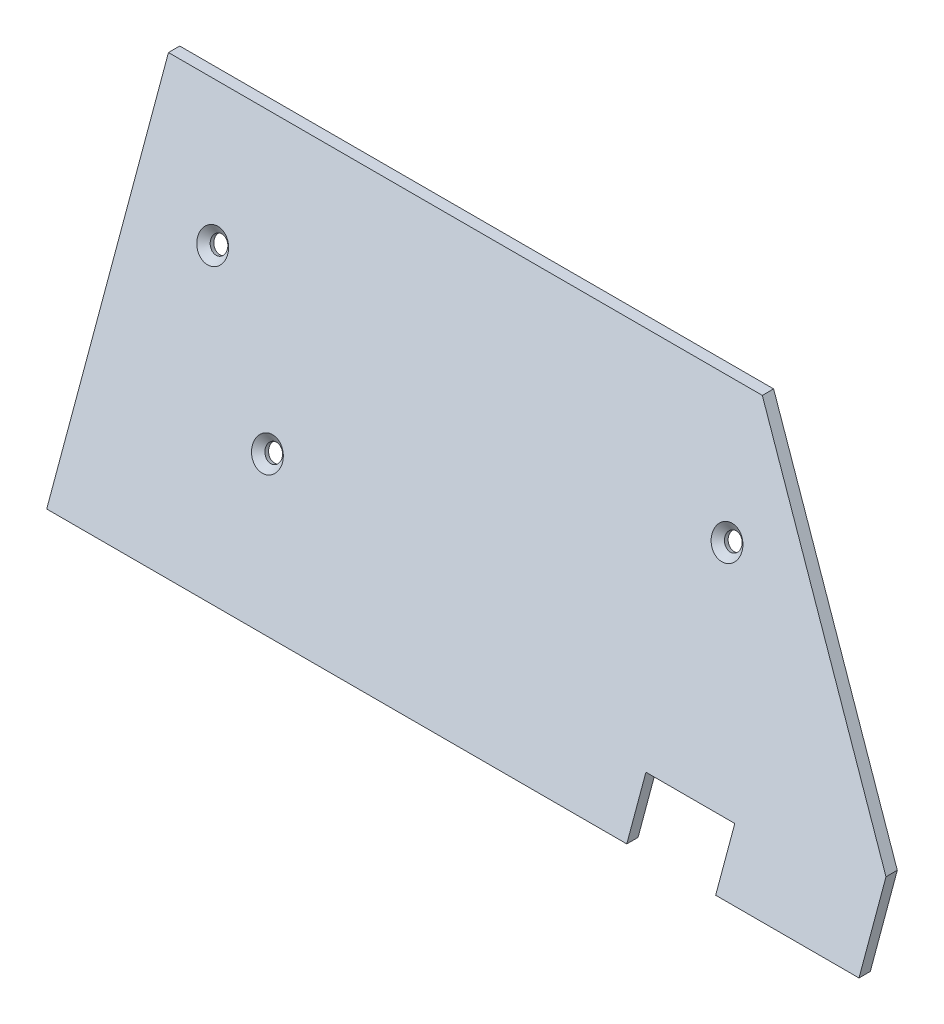
from build123d import *

# Parameters (mm, degrees)
MAIN_DEPTH                                      = 85
BACKBRACKETHOLES_D                              = 3.5
BACKBRACKETHOLES_DEPTH                          = 5
BACKBRACKETHOLES_CSINK_D                        = 6.3
BACKBRACKETHOLES_CSINK_ANGLE                    = 90
CUT_EXTRUDE1_DEPTH                              = 28.6
CSK_FOR_M3_FLAT_HEAD_MACHINE_SCREW1_D           = 3.5
CSK_FOR_M3_FLAT_HEAD_MACHINE_SCREW1_DEPTH       = 5
CSK_FOR_M3_FLAT_HEAD_MACHINE_SCREW1_CSINK_D     = 6.3
CSK_FOR_M3_FLAT_HEAD_MACHINE_SCREW1_CSINK_ANGLE = 90
CUT_EXTRUDE3_REACH                              = 145.023
CUT_EXTRUDE3_START                              = 30
SKETCH7_W                                       = 18.6
SKETCH7_H                                       = 12


with BuildPart() as part:
    # Sketch1 → Main (new, symmetric)
    with BuildSketch(Plane(origin=(0, 0, 0), x_dir=(0, 0, -1), z_dir=(1, 0, 0))):
        Polygon((0, 0), (-2.3622, 0), (23.115716399, 70), (25.477916399, 70), align=None)
    extrude(amount=MAIN_DEPTH, both=True)

    # BackBracketHoles
    with Locations(Plane(origin=(0, 0.759196446, 2.085875092), x_dir=(1, 0, 0), z_dir=(0, 0.3420201433256726, 0.9396926207859071))):
        with Locations((-67.6378, 50.002080017), (-47.6378, 25.002080017)):
            CounterSinkHole(BACKBRACKETHOLES_D / 2, BACKBRACKETHOLES_CSINK_D / 2, depth=BACKBRACKETHOLES_DEPTH, counter_sink_angle=BACKBRACKETHOLES_CSINK_ANGLE)

    # Sketch4 → Cut-Extrude1 (cut)
    with BuildSketch(Plane.XY):
        Polygon((39.288306747, 70), (100, -2.353378547), (100, 70), align=None)
    extrude(amount=-CUT_EXTRUDE1_DEPTH, mode=Mode.SUBTRACT)

    # CSK for M3 Flat Head Machine Screw1
    with Locations(Plane(origin=(0, 0.759196446, 2.085875092), x_dir=(1, 0, 0), z_dir=(0, 0.3420201433256726, 0.9396926207859071))):
        with Locations((40, 50.002080017)):
            CounterSinkHole(CSK_FOR_M3_FLAT_HEAD_MACHINE_SCREW1_D / 2, CSK_FOR_M3_FLAT_HEAD_MACHINE_SCREW1_CSINK_D / 2, depth=CSK_FOR_M3_FLAT_HEAD_MACHINE_SCREW1_DEPTH, counter_sink_angle=CSK_FOR_M3_FLAT_HEAD_MACHINE_SCREW1_CSINK_ANGLE)

    # Cut-Extrude3: up to this plane
    cut_extrude3_end = Plane(origin=(85, 70, -25.477916399), z_dir=(0, 0.3420201433256726, 0.939692620785907))
    # Sketch7 → Cut-Extrude3 (cut, up to the surface)
    with BuildSketch(Plane.XY.offset(CUT_EXTRUDE3_START), mode=Mode.PRIVATE) as cut_extrude3_sk1:
        with Locations((45.7, 5.001954577)):
            Rectangle(SKETCH7_W, SKETCH7_H)
    cut_extrude3_tool1 = split(extrude(cut_extrude3_sk1.sketch, amount=-CUT_EXTRUDE3_REACH, mode=Mode.PRIVATE), bisect_by=cut_extrude3_end, keep=Keep.BOTH, mode=Mode.PRIVATE)
    add(cut_extrude3_tool1.solids().sort_by_distance((45.7, 5.001955, 30))[0], mode=Mode.SUBTRACT)


solid = part.part
